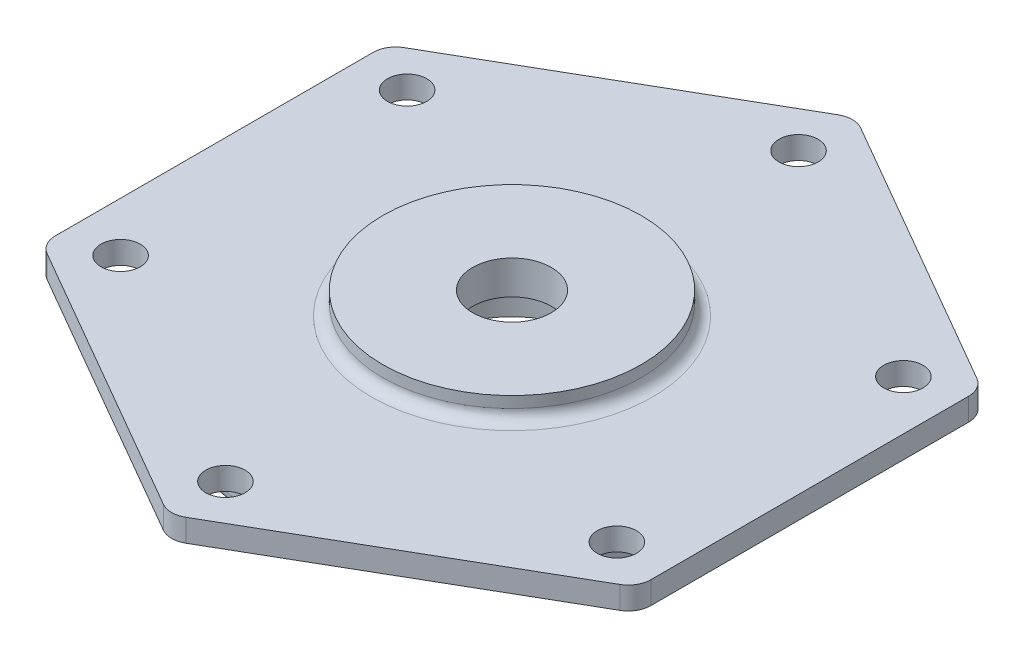
from build123d import *

# Parameters (mm, degrees)
BOSS_EXTRUDE1_DEPTH = 4
SKETCH2_R           = 23
BOSS_EXTRUDE2_DEPTH = 4
SKETCH3_R           = 45
BOSS_EXTRUDE3_DEPTH = 6
SKETCH4_R           = 40
SKETCH4_R_2         = 19
CUT_EXTRUDE1_DEPTH  = 6
SKETCH5_R           = 14
CUT_EXTRUDE2_DEPTH  = 8
SKETCH6_R           = 7
CUT_EXTRUDE3_DEPTH  = 81.888663881
FILLET1_R           = 2
FILLET2_R           = 2
FILLET3_R           = 2
SKETCH7_R           = 3.5
CUT_EXTRUDE4_DEPTH  = 82.110886719


with BuildPart() as part:
    # Sketch1 → Boss-Extrude1 (new body)
    with BuildSketch(Plane(origin=(0, 0, 0), x_dir=(1, 0, 0), z_dir=(0, 1, 0))):
        with BuildLine():
            Line((2, -60.044427996), (51, -31.754264805))
            ThreePointArc((51, -31.754264805), (52.464101615, -30.29016319), (53, -28.29016319))
            Line((53, -28.29016319), (53, 28.29016319))
            ThreePointArc((53, 28.29016319), (52.464101615, 30.29016319), (51, 31.754264805))
            Line((51, 31.754264805), (2, 60.044427996))
            ThreePointArc((2, 60.044427996), (0, 60.580326381), (-2, 60.044427996))
            Line((-2, 60.044427996), (-51, 31.754264805))
            ThreePointArc((-51, 31.754264805), (-52.464101615, 30.29016319), (-53, 28.29016319))
            Line((-53, 28.29016319), (-53, -28.29016319))
            ThreePointArc((-53, -28.29016319), (-52.464101615, -30.29016319), (-51, -31.754264805))
            Line((-51, -31.754264805), (-2, -60.044427996))
            ThreePointArc((-2, -60.044427996), (0, -60.580326381), (2, -60.044427996))
        make_face()
    extrude(amount=BOSS_EXTRUDE1_DEPTH)

    # Sketch2 → Boss-Extrude2 (add)
    with BuildSketch(Plane(origin=(0, 4, 0), x_dir=(1, 0, 0), z_dir=(0, 1, 0))):
        Circle(SKETCH2_R)
    extrude(amount=BOSS_EXTRUDE2_DEPTH)

    # Sketch3 → Boss-Extrude3 (add)
    with BuildSketch(Plane.XZ):
        Circle(SKETCH3_R)
    extrude(amount=BOSS_EXTRUDE3_DEPTH)

    # Sketch4 → Cut-Extrude1 (cut)
    with BuildSketch(Plane.XZ.offset(6)):
        Circle(SKETCH4_R)
        with Locations((1.215957684, 0)):
            Circle(SKETCH4_R_2, mode=Mode.SUBTRACT)
    extrude(amount=-CUT_EXTRUDE1_DEPTH, mode=Mode.SUBTRACT)

    # Sketch5 → Cut-Extrude2 (cut)
    with BuildSketch(Plane.XZ.offset(6)):
        Circle(SKETCH5_R)
    extrude(amount=-CUT_EXTRUDE2_DEPTH, mode=Mode.SUBTRACT)

    # Sketch6 → Cut-Extrude3 (cut, through all)
    with BuildSketch(Plane.XZ.offset(-2)):
        Circle(SKETCH6_R)
    extrude(amount=-CUT_EXTRUDE3_DEPTH, mode=Mode.SUBTRACT)

    # Fillet1
    fillet1_edges = [part.edges().sort_by_distance(p)[0] for p in [
        (-17.784042316, -6, 0),
    ]]
    fillet(fillet1_edges, radius=FILLET1_R)

    # Fillet2
    fillet2_edges = [part.edges().sort_by_distance(p)[0] for p in [
        (-23, 4, 0),
    ]]
    fillet(fillet2_edges, radius=FILLET2_R)

    # Fillet3
    fillet3_edges = [part.edges().sort_by_distance(p)[0] for p in [
        (-45, -6, 0),
    ]]
    fillet(fillet3_edges, radius=FILLET3_R)

    # Sketch7 → Cut-Extrude4 (cut, through all)
    with BuildSketch(Plane(origin=(0, 4, 0), x_dir=(1, 0, 0), z_dir=(0, 1, 0))):
        with Locations((0, 51)):
            Circle(SKETCH7_R)
        with Locations((44.167295593, 25.5)):
            Circle(SKETCH7_R)
        with Locations((44.167295593, -25.5)):
            Circle(SKETCH7_R)
        with Locations((0, -51)):
            Circle(SKETCH7_R)
        with Locations((-44.167295593, -25.5)):
            Circle(SKETCH7_R)
        with Locations((-44.167295593, 25.5)):
            Circle(SKETCH7_R)
    extrude(amount=-CUT_EXTRUDE4_DEPTH, mode=Mode.SUBTRACT)


solid = part.part
